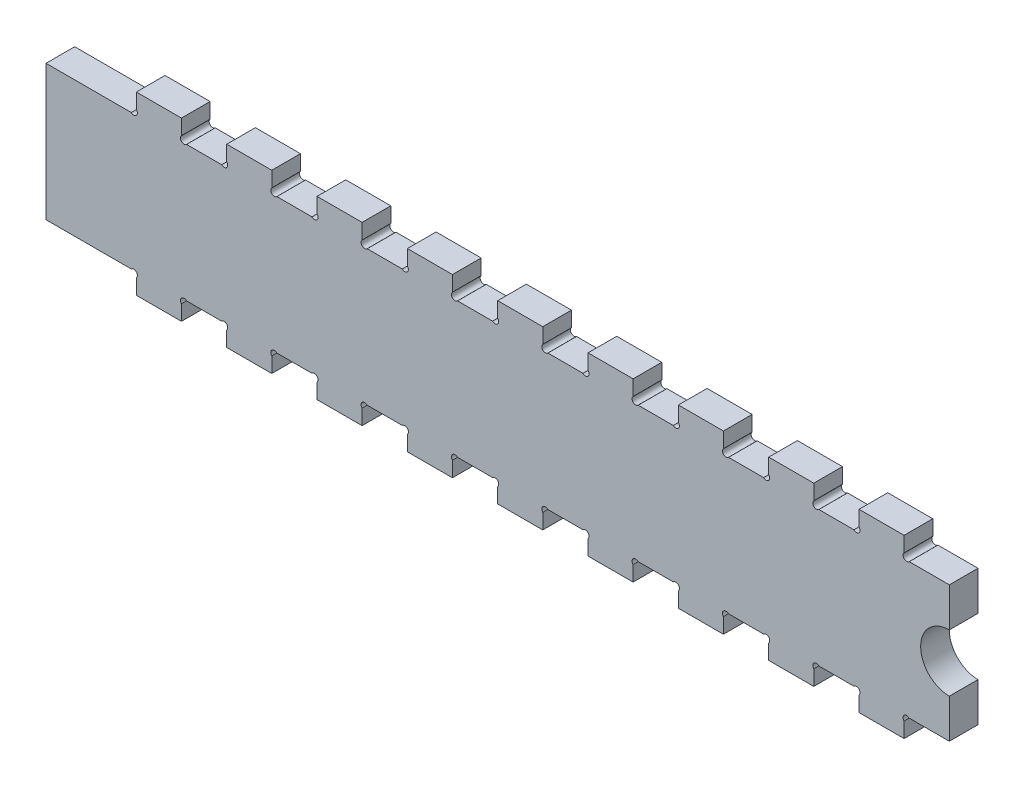
from build123d import *

# Parameters (mm, degrees)
BOSS_EXTRUDE1_DEPTH = 6.35
SKETCH2_W           = 10.0254
SKETCH2_H           = 4.477133961
CUT_EXTRUDE2_DEPTH  = 204.051450213
LPATTERN1_COUNT     = 9
LPATTERN1_PITCH     = 20
CUT_EXTRUDE5_DEPTH  = 204.051450213


# Read off the part's stored shape, not the designer's step: Boss-Extrude1
with BuildPart() as part:
    # Boss-Extrude1 outline → Boss-Extrude1 (new body)
    with BuildSketch(Plane.XY):
        with BuildLine():
            Line((190, -4.490128061), (190, -1.122532015))
            ThreePointArc((190, -1.122532015), (190, 0), (191.122532015, 0))
            Line((191.122532015, 0), (200, 0))
            Line((200, 0), (200, 30))
            Line((200, 30), (191.122532015, 30))
            ThreePointArc((191.122532015, 30), (190, 30), (190, 31.122532015))
            Line((190, 31.122532015), (190, 34.490128061))
            Line((190, 34.490128061), (180, 34.490128061))
            Line((180, 34.490128061), (180, 31.122532015))
            ThreePointArc((180, 31.122532015), (180, 30), (178.877467985, 30))
            Line((178.877467985, 30), (171.122532015, 30))
            ThreePointArc((171.122532015, 30), (170, 30), (170, 31.122532015))
            Line((170, 31.122532015), (170, 34.490128061))
            Line((170, 34.490128061), (160, 34.490128061))
            Line((160, 34.490128061), (160, 31.122532015))
            ThreePointArc((160, 31.122532015), (160, 30), (158.877467985, 30))
            Line((158.877467985, 30), (151.122532015, 30))
            ThreePointArc((151.122532015, 30), (150, 30), (150, 31.122532015))
            Line((150, 31.122532015), (150, 34.490128061))
            Line((150, 34.490128061), (140, 34.490128061))
            Line((140, 34.490128061), (140, 31.122532015))
            ThreePointArc((140, 31.122532015), (140, 30), (138.877467985, 30))
            Line((138.877467985, 30), (131.122532015, 30))
            ThreePointArc((131.122532015, 30), (130, 30), (130, 31.122532015))
            Line((130, 31.122532015), (130, 34.490128061))
            Line((130, 34.490128061), (120, 34.490128061))
            Line((120, 34.490128061), (120, 31.122532015))
            ThreePointArc((120, 31.122532015), (120, 30), (118.877467985, 30))
            Line((118.877467985, 30), (111.122532015, 30))
            ThreePointArc((111.122532015, 30), (110, 30), (110, 31.122532015))
            Line((110, 31.122532015), (110, 34.490128061))
            Line((110, 34.490128061), (100, 34.490128061))
            Line((100, 34.490128061), (100, 31.122532015))
            ThreePointArc((100, 31.122532015), (100, 30), (98.877467985, 30))
            Line((98.877467985, 30), (91.122532015, 30))
            ThreePointArc((91.122532015, 30), (90, 30), (90, 31.122532015))
            Line((90, 31.122532015), (90, 34.490128061))
            Line((90, 34.490128061), (80, 34.490128061))
            Line((80, 34.490128061), (80, 31.122532015))
            ThreePointArc((80, 31.122532015), (80, 30), (78.877467985, 30))
            Line((78.877467985, 30), (71.122532015, 30))
            ThreePointArc((71.122532015, 30), (70, 30), (70, 31.122532015))
            Line((70, 31.122532015), (70, 34.490128061))
            Line((70, 34.490128061), (60, 34.490128061))
            Line((60, 34.490128061), (60, 31.122532015))
            ThreePointArc((60, 31.122532015), (60, 30), (58.877467985, 30))
            Line((58.877467985, 30), (51.122532015, 30))
            ThreePointArc((51.122532015, 30), (50, 30), (50, 31.122532015))
            Line((50, 31.122532015), (50, 34.490128061))
            Line((50, 34.490128061), (40, 34.490128061))
            Line((40, 34.490128061), (40, 31.122532015))
            ThreePointArc((40, 31.122532015), (40, 30), (38.877467985, 30))
            Line((38.877467985, 30), (31.122532015, 30))
            ThreePointArc((31.122532015, 30), (30, 30), (30, 31.122532015))
            Line((30, 31.122532015), (30, 34.490128061))
            Line((30, 34.490128061), (20, 34.490128061))
            Line((20, 34.490128061), (20, 31.122532015))
            ThreePointArc((20, 31.122532015), (20, 30), (18.877467985, 30))
            Line((18.877467985, 30), (0, 30))
            Line((0, 30), (0, 0))
            Line((0, 0), (18.877467985, 0))
            ThreePointArc((18.877467985, 0), (20, 0), (20, -1.122532015))
            Line((20, -1.122532015), (20, -4.490128061))
            Line((20, -4.490128061), (30, -4.490128061))
            Line((30, -4.490128061), (30, -1.122532015))
            ThreePointArc((30, -1.122532015), (30, 0), (31.122532015, 0))
            Line((31.122532015, 0), (38.877467985, 0))
            ThreePointArc((38.877467985, 0), (40, 0), (40, -1.122532015))
            Line((40, -1.122532015), (40, -4.490128061))
            Line((40, -4.490128061), (50, -4.490128061))
            Line((50, -4.490128061), (50, -1.122532015))
            ThreePointArc((50, -1.122532015), (50, 0), (51.122532015, 0))
            Line((51.122532015, 0), (58.877467985, 0))
            ThreePointArc((58.877467985, 0), (60, 0), (60, -1.122532015))
            Line((60, -1.122532015), (60, -4.490128061))
            Line((60, -4.490128061), (70, -4.490128061))
            Line((70, -4.490128061), (70, -1.122532015))
            ThreePointArc((70, -1.122532015), (70, 0), (71.122532015, 0))
            Line((71.122532015, 0), (78.877467985, 0))
            ThreePointArc((78.877467985, 0), (80, 0), (80, -1.122532015))
            Line((80, -1.122532015), (80, -4.490128061))
            Line((80, -4.490128061), (90, -4.490128061))
            Line((90, -4.490128061), (90, -1.122532015))
            ThreePointArc((90, -1.122532015), (90, 0), (91.122532015, 0))
            Line((91.122532015, 0), (98.877467985, 0))
            ThreePointArc((98.877467985, 0), (100, 0), (100, -1.122532015))
            Line((100, -1.122532015), (100, -4.490128061))
            Line((100, -4.490128061), (110, -4.490128061))
            Line((110, -4.490128061), (110, -1.122532015))
            ThreePointArc((110, -1.122532015), (110, 0), (111.122532015, 0))
            Line((111.122532015, 0), (118.877467985, 0))
            ThreePointArc((118.877467985, 0), (120, 0), (120, -1.122532015))
            Line((120, -1.122532015), (120, -4.490128061))
            Line((120, -4.490128061), (130, -4.490128061))
            Line((130, -4.490128061), (130, -1.122532015))
            ThreePointArc((130, -1.122532015), (130, 0), (131.122532015, 0))
            Line((131.122532015, 0), (138.877467985, 0))
            ThreePointArc((138.877467985, 0), (140, 0), (140, -1.122532015))
            Line((140, -1.122532015), (140, -4.490128061))
            Line((140, -4.490128061), (150, -4.490128061))
            Line((150, -4.490128061), (150, -1.122532015))
            ThreePointArc((150, -1.122532015), (150, 0), (151.122532015, 0))
            Line((151.122532015, 0), (158.877467985, 0))
            ThreePointArc((158.877467985, 0), (160, 0), (160, -1.122532015))
            Line((160, -1.122532015), (160, -4.490128061))
            Line((160, -4.490128061), (170, -4.490128061))
            Line((170, -4.490128061), (170, -1.122532015))
            ThreePointArc((170, -1.122532015), (170, 0), (171.122532015, 0))
            Line((171.122532015, 0), (178.877467985, 0))
            ThreePointArc((178.877467985, 0), (180, 0), (180, -1.122532015))
            Line((180, -1.122532015), (180, -4.490128061))
            Line((180, -4.490128061), (190, -4.490128061))
        make_face()
    extrude(amount=BOSS_EXTRUDE1_DEPTH)

    # Sketch2 → Cut-Extrude2 (cut, through all)
    with BuildSketch(Plane(origin=(0, 0, 0), x_dir=(-1, 0, 0), z_dir=(0, 0, -1))):
        with Locations((-35, 32.25156108)):
            Rectangle(SKETCH2_W, SKETCH2_H)
        with Locations((-35, -2.251561081)):
            Rectangle(SKETCH2_W, SKETCH2_H)
    cut_extrude2 = extrude(amount=-CUT_EXTRUDE2_DEPTH, mode=Mode.SUBTRACT)

    # LPattern1: Cut-Extrude2 ×9
    with Locations(*[(i * LPATTERN1_PITCH, 0, 0) for i in range(1, LPATTERN1_COUNT)]):
        add(cut_extrude2, mode=Mode.SUBTRACT)

    # Sketch6 → Cut-Extrude5 (cut, through all)
    with BuildSketch(Plane(origin=(0, 0, 0), x_dir=(-1, 0, 0), z_dir=(0, 0, -1))):
        with BuildLine():
            Line((-200, 8.65), (-200, 21.35))
            ThreePointArc((-200, 21.35), (-193.65, 15), (-200, 8.65))
        make_face()
    extrude(amount=-CUT_EXTRUDE5_DEPTH, mode=Mode.SUBTRACT)


solid = part.part
